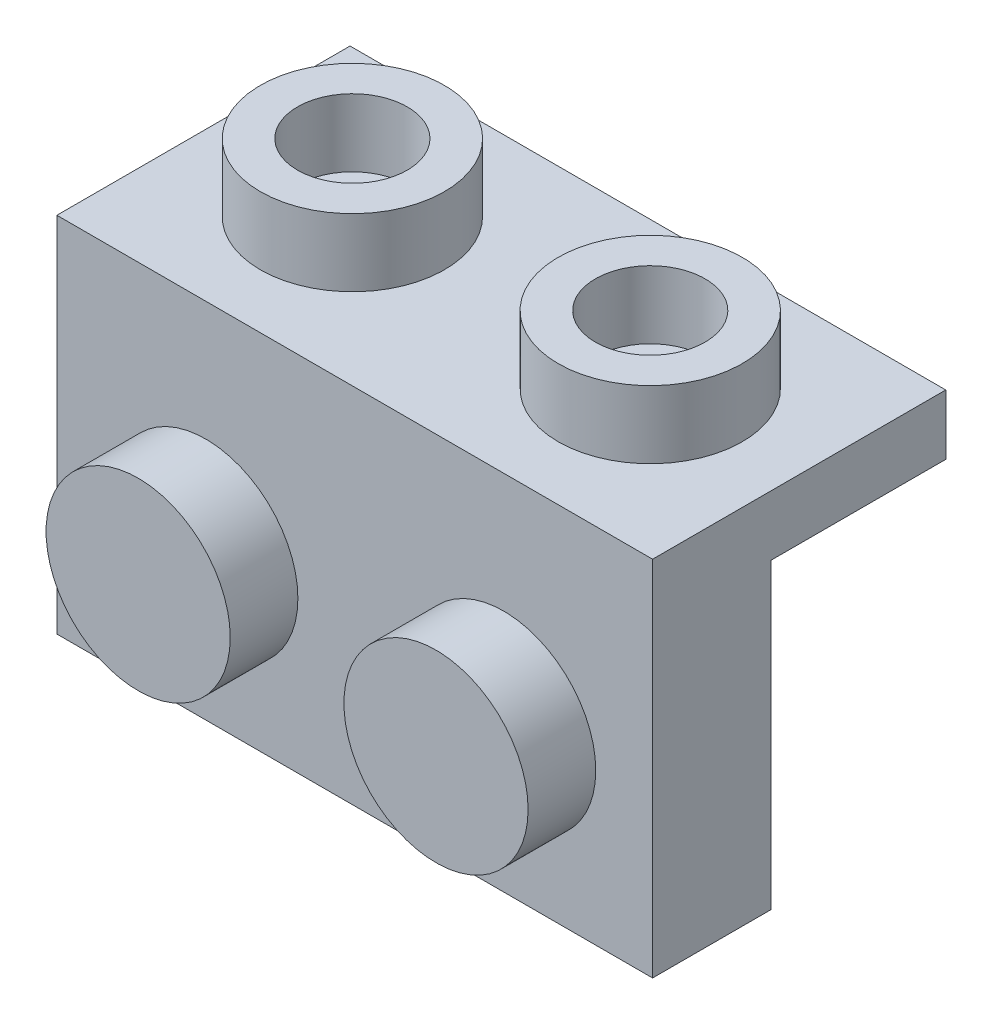
from build123d import *

# Parameters (mm, degrees)
BOSS_EXTRUDE1_DEPTH = 15.85
SKETCH2_R           = 2.45
SKETCH2_R_2         = 1.46
BOSS_EXTRUDE2_DEPTH = 1.8
SKETCH3_R           = 2.45
BOSS_EXTRUDE3_DEPTH = 1.8
SHELL1_START        = -3.15
SHELL1_OUTLINE_W    = 12.85
SHELL1_OUTLINE_H    = 6.65
SHELL1_DEPTH        = 1.65
SHELL1_START_2      = -1.5
SHELL1_2_OUTLINE_R  = 0.95
SHELL1_2_DEPTH      = 1.8


# Read off the part's stored shape, not the designer's step: Shell1
with BuildPart() as part:
    # Sketch1 → Boss-Extrude1 (new body)
    with BuildSketch(Plane(origin=(0, 0, 0), x_dir=(0, 0, -1), z_dir=(1, 0, 0))):
        Polygon((0, 0), (0, -9.65), (3.15, -9.65), (3.15, -1.6), (7.8, -1.6), (7.8, 0), align=None)
    extrude(amount=-BOSS_EXTRUDE1_DEPTH)

    # Sketch2 → Boss-Extrude2 (add)
    # profile 1 of 2: a face of its own
    with BuildSketch(Plane(origin=(0, 0, 0), x_dir=(1, 0, 0), z_dir=(0, 1, 0))):
        with Locations(Location((-11.8875, 3.9, 0), (0, 0, 270))):
            Circle(SKETCH2_R)
        with Locations(Location((-11.8875, 3.9, 0), (0, 0, 270))):
            Circle(SKETCH2_R_2, mode=Mode.SUBTRACT)
    # profile 2 of 2: a face of its own
    with BuildSketch(Plane(origin=(0, 0, 0), x_dir=(1, 0, 0), z_dir=(0, 1, 0))):
        with Locations(Location((-3.9625, 3.9, 0), (0, 0, 270))):
            Circle(SKETCH2_R)
        with Locations(Location((-3.9625, 3.9, 0), (0, 0, 270))):
            Circle(SKETCH2_R_2, mode=Mode.SUBTRACT)
    extrude(amount=BOSS_EXTRUDE2_DEPTH)

    # Sketch3 → Boss-Extrude3 (add)
    with BuildSketch(Plane.XY):
        with Locations((-11.8875, -5.625)):
            Circle(SKETCH3_R)
        with Locations((-3.9625, -5.625)):
            Circle(SKETCH3_R)
    extrude(amount=BOSS_EXTRUDE3_DEPTH)

    # Shell1 outline → Shell1 (cut)
    with BuildSketch(Plane.XY.offset(SHELL1_START)):
        with Locations((-7.925, -4.825)):
            Rectangle(SHELL1_OUTLINE_W, SHELL1_OUTLINE_H)
    extrude(amount=SHELL1_DEPTH, mode=Mode.SUBTRACT)

    # Shell1 2 outline → Shell1 2 (cut)
    with BuildSketch(Plane.XY.offset(SHELL1_START_2)):
        with Locations((-11.8875, -5.625)):
            Circle(SHELL1_2_OUTLINE_R)
        with Locations((-3.9625, -5.625)):
            Circle(SHELL1_2_OUTLINE_R)
    extrude(amount=SHELL1_2_DEPTH, mode=Mode.SUBTRACT)


solid = part.part
